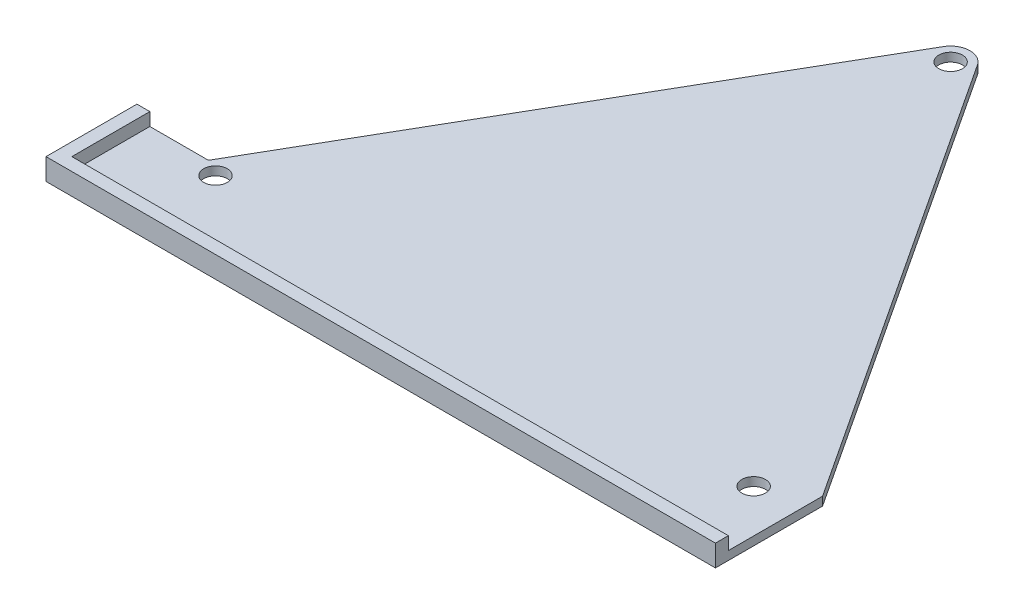
from build123d import *

# Parameters (mm, degrees)
SKETCH1_R           = 2.75
BOSS_EXTRUDE4_DEPTH = 2
BOSS_EXTRUDE7_DEPTH = 5


with BuildPart() as part:
    # Sketch1 → Boss-Extrude4 (new body)
    with BuildSketch(Plane(origin=(0, 0, 0), x_dir=(1, 0, 0), z_dir=(0, 1, 0))):
        with BuildLine():
            ThreePointArc((3.897114317, 56.376587737), (0, 58.626587737), (-3.897114317, 56.376587737))
            Line((-3.897114317, 56.376587737), (-66.397114317, -51.876587737))
            Line((-66.397114317, -51.876587737), (-80, -51.876587737))
            Line((-80, -51.876587737), (-80, -70))
            Line((-80, -70), (72.5, -70))
            Line((72.5, -70), (72.5, -48.115728134))
            Line((72.5, -48.115728134), (3.897114317, 56.376587737))
        make_face()
        with Locations((-62.5, -54.126587737)):
            Circle(SKETCH1_R, mode=Mode.SUBTRACT)
        with Locations((62.5, -54.126587737)):
            Circle(SKETCH1_R, mode=Mode.SUBTRACT)
        with Locations((0, 54.126587737)):
            Circle(SKETCH1_R, mode=Mode.SUBTRACT)
    extrude(amount=BOSS_EXTRUDE4_DEPTH)

    # Sketch1<6> → Boss-Extrude7 (add)
    with BuildSketch(Plane(origin=(0, 0, 0), x_dir=(1, 0, 0), z_dir=(0, 1, 0))):
        Polygon((-80, -70), (-80, -51.876587737), (-83, -51.876587737), (-83, -73), (72.5, -73), (72.5, -70), align=None)
    extrude(amount=BOSS_EXTRUDE7_DEPTH)


solid = part.part
